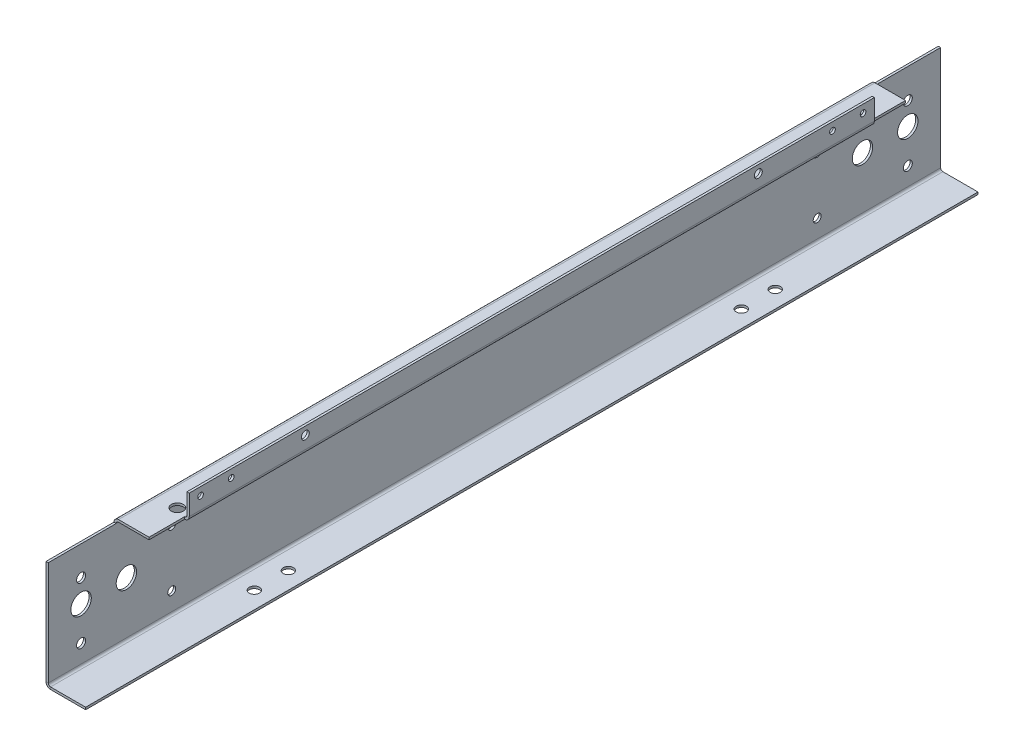
from build123d import *

# Parameters (mm, degrees)
SM_BASE_FLANGE_1_DEPTH = 394
SKETCH_6_W             = 35
SKETCH_6_H             = 60
CUT_EXTRUDE_1_DEPTH    = 24
CUT_EXTRUDE_START      = -22
SKETCH_11_W            = 4
SKETCH_11_H            = 31.5
CUT_EXTRUDE_6_DEPTH    = 22
SKETCH_8_R             = 9
SKETCH_8_R_2           = 4
SKETCH_8_R_3           = 3.5
CUT_EXTRUDE_3_DEPTH    = 10
SKETCH_12_R            = 2.5
CUT_EXTRUDE_7_DEPTH    = 10
SKETCH_13_R            = 5.25
CUT_EXTRUDE_8_DEPTH    = 10
SKETCH_14_R            = 4.5
CUT_EXTRUDE_9_DEPTH    = 10
SKETCH_15_R            = 3.5
CUT_EXTRUDE_2621_DEPTH = 10


# Sheet-metal steps are written as plain solids
with BuildPart() as part:
    # Sketch 1 → Базовая кромка1 (new, symmetric)
    with BuildSketch(Plane.XY):
        with BuildLine():
            Line((0, 0), (0, -18))
            ThreePointArc((0, -18), (-1.171572875, -20.828427125), (-4, -22))
            Line((-4, -22), (-31, -22))
            ThreePointArc((-31, -22), (-32.414213562, -22.585786438), (-33, -24))
            Line((-33, -24), (-33, -116))
            ThreePointArc((-33, -116), (-32.414213562, -117.414213562), (-31, -118))
            Line((-31, -118), (0, -118))
            Line((0, -118), (0, -120))
            Line((0, -120), (-31, -120))
            ThreePointArc((-31, -120), (-33.828427125, -118.828427125), (-35, -116))
            Line((-35, -116), (-35, -24))
            ThreePointArc((-35, -24), (-33.828427125, -21.171572875), (-31, -20))
            Line((-31, -20), (-4, -20))
            ThreePointArc((-4, -20), (-2.585786438, -19.414213562), (-2, -18))
            Line((-2, -18), (-2, 0))
            Line((-2, 0), (0, 0))
        make_face()
    extrude(amount=SM_BASE_FLANGE_1_DEPTH, both=True)

    # Эскиз6 → Вырез-Вытянуть1 (cut)
    with BuildSketch(Plane(origin=(0, 0, 0), x_dir=(1, 0, 0), z_dir=(0, 1, 0))):
        with Locations((-17.5, -364)):
            Rectangle(SKETCH_6_W, SKETCH_6_H)
        with Locations((-17.5, 364)):
            Rectangle(SKETCH_6_W, SKETCH_6_H)
    extrude(amount=-CUT_EXTRUDE_1_DEPTH, mode=Mode.SUBTRACT)

    # Эскиз11 → Вырез-Вытянуть6 (cut)
    with BuildSketch(Plane(origin=(0, 0, 0), x_dir=(1, 0, 0), z_dir=(0, 1, 0)).offset(CUT_EXTRUDE_START)):
        with Locations((-2, 318.25)):
            Rectangle(SKETCH_11_W, SKETCH_11_H)
        with Locations((-2, -318.25)):
            Rectangle(SKETCH_11_W, SKETCH_11_H)
    extrude(amount=CUT_EXTRUDE_6_DEPTH, mode=Mode.SUBTRACT)

    # Эскиз8 → Вырез-Вытянуть3 (cut)
    with BuildSketch(Plane.ZY.offset(35)):
        with Locations(Location((-365, -70, 0), (0, 0, 270))):
            Circle(SKETCH_8_R)
        with Locations(Location((-325, -70, 0), (0, 0, 270))):
            Circle(SKETCH_8_R)
        with Locations(Location((-365, -50, 0), (0, 0, 270))):
            Circle(SKETCH_8_R_2)
        with Locations(Location((-365, -100, 0), (0, 0, 270))):
            Circle(SKETCH_8_R_2)
        with Locations(Location((-285, -50, 0), (0, 0, 270))):
            Circle(SKETCH_8_R_3)
        with Locations(Location((-285, -100, 0), (0, 0, 270))):
            Circle(SKETCH_8_R_3)
        with Locations(Location((285, -100, 0), (0, 0, 90))):
            Circle(SKETCH_8_R_3)
        with Locations(Location((285, -50, 0), (0, 0, 90))):
            Circle(SKETCH_8_R_3)
        with Locations(Location((365, -100, 0), (0, 0, 90))):
            Circle(SKETCH_8_R_2)
        with Locations(Location((365, -50, 0), (0, 0, 90))):
            Circle(SKETCH_8_R_2)
        with Locations(Location((325, -70, 0), (0, 0, 90))):
            Circle(SKETCH_8_R)
        with Locations(Location((365, -70, 0), (0, 0, 90))):
            Circle(SKETCH_8_R)
    extrude(amount=-CUT_EXTRUDE_3_DEPTH, mode=Mode.SUBTRACT)

    # Эскиз12 → Вырез-Вытянуть7 (cut)
    with BuildSketch(Plane.ZY.offset(2)):
        with Locations(Location((-292.5, -7, 0), (0, 0, 270))):
            Circle(SKETCH_12_R)
        with Locations(Location((-265.5, -7, 0), (0, 0, 270))):
            Circle(SKETCH_12_R)
        with Locations(Location((265.5, -7, 0), (0, 0, 90))):
            Circle(SKETCH_12_R)
        with Locations(Location((292.5, -7, 0), (0, 0, 90))):
            Circle(SKETCH_12_R)
    extrude(amount=-CUT_EXTRUDE_7_DEPTH, mode=Mode.SUBTRACT)

    # Эскиз13 → Вырез-Вытянуть8 (cut)
    with BuildSketch(Plane(origin=(0, -20, 0), x_dir=(1, 0, 0), z_dir=(0, 1, 0))):
        with Locations(Location((-14, 299, 0), (0, 0, 180))):
            Circle(SKETCH_13_R)
        with Locations((-14, -299)):
            Circle(SKETCH_13_R)
    extrude(amount=-CUT_EXTRUDE_8_DEPTH, mode=Mode.SUBTRACT)

    # Эскиз14 → Вырез-Вытянуть9 (cut)
    with BuildSketch(Plane(origin=(0, -118, 0), x_dir=(1, 0, 0), z_dir=(0, 1, 0))):
        with Locations(Location((-15, 230, 0), (0, 0, 180))):
            Circle(SKETCH_14_R)
        with Locations((-15, -230)):
            Circle(SKETCH_14_R)
        with Locations(Location((-15, 200, 0), (0, 0, 180))):
            Circle(SKETCH_14_R)
        with Locations((-15, -200)):
            Circle(SKETCH_14_R)
    extrude(amount=-CUT_EXTRUDE_9_DEPTH, mode=Mode.SUBTRACT)

    # Эскиз15 → Cut-Extrude 2621 (cut)
    with BuildSketch(Plane(origin=(0, 0, 0), x_dir=(0, 0, -1), z_dir=(1, 0, 0))):
        with Locations(Location((-200, -7, 0), (0, 0, 90))):
            Circle(SKETCH_15_R)
        with Locations(Location((200, -7, 0), (0, 0, 270))):
            Circle(SKETCH_15_R)
    extrude(amount=-CUT_EXTRUDE_2621_DEPTH, mode=Mode.SUBTRACT)


solid = part.part
